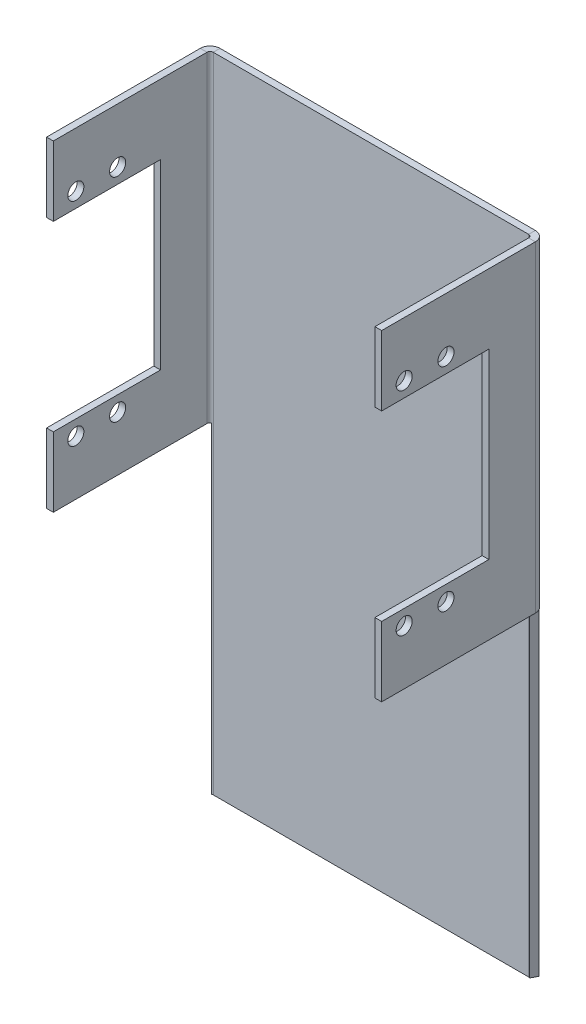
from build123d import *

# Parameters (mm, degrees)
SKETCH1_R                  = 1.905
BASE_FLANGE1_DEPTH         = 1.6
SKETCHED_START             = -76.2
SKETCHED_BEND1_OUTLINE_W   = 76.2
SKETCHED_BEND1_OUTLINE_H   = 1.6
SKETCHED_BEND1_DEPTH       = 36.5
SKETCHED_START_2           = 39.7
SKETCHED_BEND1_2_OUTLINE_W = 76.2
SKETCHED_BEND1_2_OUTLINE_H = 1.6
SKETCHED_BEND1_2_DEPTH     = 36.5
SKETCHED_START_3           = -39.7
SKETCHED_BEND1_3_OUTLINE_R = 1.905
SKETCHED_BEND1_3_DEPTH     = 2.3366
SKETCHED_START_4           = 37.3634
SKETCHED_BEND1_4_OUTLINE_R = 1.905
SKETCHED_BEND1_4_DEPTH     = 2.3366
SKETCHED_START_5           = -38.441087378
SKETCHED_BEND1_5_OUTLINE_W = 76.2
SKETCHED_BEND1_5_OUTLINE_H = 1.6
SKETCHED_BEND1_5_DEPTH     = 0.341087378
SKETCHED_START_6           = 38.1
SKETCHED_BEND1_6_OUTLINE_W = 76.2
SKETCHED_BEND1_6_OUTLINE_H = 1.6
SKETCHED_BEND1_6_DEPTH     = 0.341087378
SKETCHED_START_7           = -77
SKETCHED_BEND1_7_DEPTH     = 154
SKETCHED_BEND1_8_DEPTH     = 77
SKETCHED_BEND1_9_DEPTH     = 76.2


with BuildPart() as part:
    # Base-Flange1: sheet metal written as solids
    # Sketch1 → Base-Flange1 (new body)
    with BuildSketch(Plane.XY):
        Polygon((-76.2, 59.69), (-50.8, 59.69), (-50.8, 16.51), (-76.2, 16.51), (-76.2, 0), (-38.1, 0), (-38.1, -76.2), (38.1, -76.2), (38.1, 0), (76.2, 0), (76.2, 16.51), (50.8, 16.51), (50.8, 59.69), (76.2, 59.69), (76.2, 76.2), (-76.2, 76.2), align=None)
        with Locations((-60.96, 63.246)):
            Circle(SKETCH1_R, mode=Mode.SUBTRACT)
        with Locations((-70.866, 63.246)):
            Circle(SKETCH1_R, mode=Mode.SUBTRACT)
        with Locations(Location((-70.866, 12.954, 0), (0, 0, 180))):
            Circle(SKETCH1_R, mode=Mode.SUBTRACT)
        with Locations(Location((-60.96, 12.954, 0), (0, 0, 180))):
            Circle(SKETCH1_R, mode=Mode.SUBTRACT)
        with Locations((60.96, 12.954)):
            Circle(SKETCH1_R, mode=Mode.SUBTRACT)
        with Locations((70.866, 12.954)):
            Circle(SKETCH1_R, mode=Mode.SUBTRACT)
        with Locations(Location((70.866, 63.246, 0), (0, 0, 180))):
            Circle(SKETCH1_R, mode=Mode.SUBTRACT)
        with Locations(Location((60.96, 63.246, 0), (0, 0, 180))):
            Circle(SKETCH1_R, mode=Mode.SUBTRACT)
    extrude(amount=-BASE_FLANGE1_DEPTH)

    # Sketched Bend1: read off the stored shape, not the designer's step
    # Sketched Bend1 outline → Sketched Bend1 (cut)
    with BuildSketch(Plane.YZ.offset(SKETCHED_START)):
        with Locations((38.1, -0.8)):
            Rectangle(SKETCHED_BEND1_OUTLINE_W, SKETCHED_BEND1_OUTLINE_H)
    extrude(amount=SKETCHED_BEND1_DEPTH, mode=Mode.SUBTRACT)

    # Sketched Bend1 2 outline → Sketched Bend1 2 (cut)
    with BuildSketch(Plane.YZ.offset(SKETCHED_START_2)):
        with Locations((38.1, -0.8)):
            Rectangle(SKETCHED_BEND1_2_OUTLINE_W, SKETCHED_BEND1_2_OUTLINE_H)
    extrude(amount=SKETCHED_BEND1_2_DEPTH, mode=Mode.SUBTRACT)

    # Sketched Bend1 3 outline → Sketched Bend1 3 (add)
    with BuildSketch(Plane.YZ.offset(SKETCHED_START_3)):
        Polygon((0, 0), (76.2, 0), (76.2, 37.159514364), (59.69, 37.159514364), (59.69, 11.759514364), (16.51, 11.759514364), (16.51, 37.159514364), (0, 37.159514364), align=None)
        with Locations((12.954, 21.919514364)):
            Circle(SKETCHED_BEND1_3_OUTLINE_R, mode=Mode.SUBTRACT)
        with Locations((63.246, 21.919514364)):
            Circle(SKETCHED_BEND1_3_OUTLINE_R, mode=Mode.SUBTRACT)
        with Locations((12.954, 31.825514364)):
            Circle(SKETCHED_BEND1_3_OUTLINE_R, mode=Mode.SUBTRACT)
        with Locations((63.246, 31.825514364)):
            Circle(SKETCHED_BEND1_3_OUTLINE_R, mode=Mode.SUBTRACT)
    extrude(amount=SKETCHED_BEND1_3_DEPTH)

    # Sketched Bend1 4 outline → Sketched Bend1 4 (add)
    with BuildSketch(Plane.YZ.offset(SKETCHED_START_4)):
        Polygon((0, 0), (76.2, 0), (76.2, 37.159514364), (59.69, 37.159514364), (59.69, 11.759514364), (16.51, 11.759514364), (16.51, 37.159514364), (0, 37.159514364), align=None)
        with Locations((12.954, 21.919514364)):
            Circle(SKETCHED_BEND1_4_OUTLINE_R, mode=Mode.SUBTRACT)
        with Locations((63.246, 21.919514364)):
            Circle(SKETCHED_BEND1_4_OUTLINE_R, mode=Mode.SUBTRACT)
        with Locations((12.954, 31.825514364)):
            Circle(SKETCHED_BEND1_4_OUTLINE_R, mode=Mode.SUBTRACT)
        with Locations((63.246, 31.825514364)):
            Circle(SKETCHED_BEND1_4_OUTLINE_R, mode=Mode.SUBTRACT)
    extrude(amount=SKETCHED_BEND1_4_DEPTH)

    # Sketched Bend1 5 outline → Sketched Bend1 5 (add)
    with BuildSketch(Plane.YZ.offset(SKETCHED_START_5)):
        with Locations((-38.1, -0.8)):
            Rectangle(SKETCHED_BEND1_5_OUTLINE_W, SKETCHED_BEND1_5_OUTLINE_H)
    extrude(amount=SKETCHED_BEND1_5_DEPTH)

    # Sketched Bend1 6 outline → Sketched Bend1 6 (add)
    with BuildSketch(Plane.YZ.offset(SKETCHED_START_6)):
        with Locations((-38.1, -0.8)):
            Rectangle(SKETCHED_BEND1_6_OUTLINE_W, SKETCHED_BEND1_6_OUTLINE_H)
    extrude(amount=SKETCHED_BEND1_6_DEPTH)

    # Sketched Bend1 7 outline → Sketched Bend1 7 (cut)
    with BuildSketch(Plane(origin=(0, 0, 0), x_dir=(1, 0, 0), z_dir=(0, 1, 0)).offset(SKETCHED_START_7)):
        with BuildLine():
            Line((-37.3634, 1.6), (-39.7, 1.6))
            Line((-39.7, 1.6), (-39.7, -0.7366))
            ThreePointArc((-39.7, -0.7366), (-39.015625705, 0.915625705), (-37.3634, 1.6))
        make_face()
        with BuildLine():
            ThreePointArc((-37.3634, 0), (-37.884254855, -0.215745145), (-38.1, -0.7366))
            Line((-38.1, -0.7366), (-38.1, -37.159514364))
            Line((-38.1, -37.159514364), (-37.3634, -37.159514364))
            Line((-37.3634, -37.159514364), (-37.3634, 0))
        make_face()
        with BuildLine():
            ThreePointArc((37.3634, 1.6), (39.015625705, 0.915625705), (39.7, -0.7366))
            Line((39.7, -0.7366), (39.7, 1.6))
            Line((39.7, 1.6), (37.3634, 1.6))
        make_face()
        with BuildLine():
            Line((37.3634, 0), (37.3634, -37.159514364))
            Line((37.3634, -37.159514364), (38.1, -37.159514364))
            Line((38.1, -37.159514364), (38.1, -0.7366))
            ThreePointArc((38.1, -0.7366), (37.884254855, -0.215745145), (37.3634, 0))
        make_face()
    extrude(amount=SKETCHED_BEND1_7_DEPTH, mode=Mode.SUBTRACT)

    # Sketched Bend1 8 outline → Sketched Bend1 8 (cut)
    with BuildSketch(Plane(origin=(0, 0, 0), x_dir=(1, 0, 0), z_dir=(0, 1, 0)).offset(SKETCHED_START_7)):
        Polygon((-37.746292342, 0), (-38.441087378, 1.33663165), (-38.441087378, 0), align=None)
        Polygon((38.441087378, 0), (38.441087378, 1.33663165), (37.746292342, 0), align=None)
    extrude(amount=SKETCHED_BEND1_8_DEPTH, mode=Mode.SUBTRACT)

    # Sketched Bend1 9 outline → Sketched Bend1 9 (add)
    with BuildSketch(Plane(origin=(0, 0, 0), x_dir=(1, 0, 0), z_dir=(0, 1, 0)).offset(SKETCHED_START)):
        with BuildLine():
            Line((-37.3634, 0), (-37.746292342, 0))
            Line((-37.746292342, 0), (-37.703134881, -0.08302539))
            ThreePointArc((-37.703134881, -0.08302539), (-37.538266381, -0.021057333), (-37.3634, 0))
        make_face()
        with BuildLine():
            Line((37.746292342, 0), (37.3634, 0))
            ThreePointArc((37.3634, 0), (37.538266381, -0.021057333), (37.703134881, -0.08302539))
            Line((37.703134881, -0.08302539), (37.746292342, 0))
        make_face()
    extrude(amount=SKETCHED_BEND1_9_DEPTH)


solid = part.part
